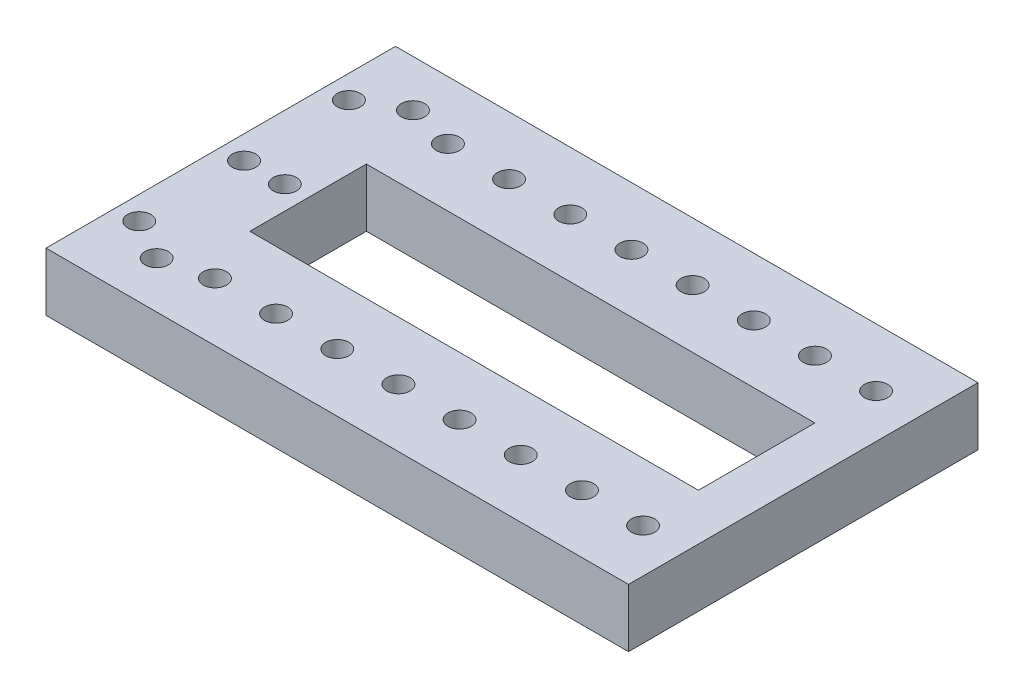
from build123d import *

# Parameters (mm, degrees)
SKETCH1_W           = 100
SKETCH1_H           = 60
SKETCH1_R           = 2
SKETCH1_W_2         = 77
SKETCH1_H_2         = 20
BOSS_EXTRUDE1_DEPTH = 10


with BuildPart() as part:
    # Sketch1 → Boss-Extrude1 (new body)
    with BuildSketch(Plane(origin=(0, 0, 0), x_dir=(1, 0, 0), z_dir=(0, 1, 0))):
        with Locations((50, 30)):
            Rectangle(SKETCH1_W, SKETCH1_H)
        with Locations((4, 48)):
            Circle(SKETCH1_R, mode=Mode.SUBTRACT)
        with Locations((11, 52)):
            Circle(SKETCH1_R, mode=Mode.SUBTRACT)
        with Locations((4, 30)):
            Circle(SKETCH1_R, mode=Mode.SUBTRACT)
        with Locations((11, 30)):
            Circle(SKETCH1_R, mode=Mode.SUBTRACT)
        with Locations((4, 12)):
            Circle(SKETCH1_R, mode=Mode.SUBTRACT)
        with Locations((11, 8)):
            Circle(SKETCH1_R, mode=Mode.SUBTRACT)
        with Locations((19, 10)):
            Circle(SKETCH1_R, mode=Mode.SUBTRACT)
        with Locations((19, 50)):
            Circle(SKETCH1_R, mode=Mode.SUBTRACT)
        with Locations((29.5, 50)):
            Circle(SKETCH1_R, mode=Mode.SUBTRACT)
        with Locations((29.5, 10)):
            Circle(SKETCH1_R, mode=Mode.SUBTRACT)
        with Locations((40, 50)):
            Circle(SKETCH1_R, mode=Mode.SUBTRACT)
        with Locations((40, 10)):
            Circle(SKETCH1_R, mode=Mode.SUBTRACT)
        with Locations((50.5, 50)):
            Circle(SKETCH1_R, mode=Mode.SUBTRACT)
        with Locations((50.5, 10)):
            Circle(SKETCH1_R, mode=Mode.SUBTRACT)
        with Locations((61, 50)):
            Circle(SKETCH1_R, mode=Mode.SUBTRACT)
        with Locations((61, 10)):
            Circle(SKETCH1_R, mode=Mode.SUBTRACT)
        with Locations((71.5, 50)):
            Circle(SKETCH1_R, mode=Mode.SUBTRACT)
        with Locations((71.5, 10)):
            Circle(SKETCH1_R, mode=Mode.SUBTRACT)
        with Locations((82, 50)):
            Circle(SKETCH1_R, mode=Mode.SUBTRACT)
        with Locations((82, 10)):
            Circle(SKETCH1_R, mode=Mode.SUBTRACT)
        with Locations((92.5, 50)):
            Circle(SKETCH1_R, mode=Mode.SUBTRACT)
        with Locations((92.5, 10)):
            Circle(SKETCH1_R, mode=Mode.SUBTRACT)
        with Locations((53.5, 30)):
            Rectangle(SKETCH1_W_2, SKETCH1_H_2, mode=Mode.SUBTRACT)
    extrude(amount=BOSS_EXTRUDE1_DEPTH)


solid = part.part
